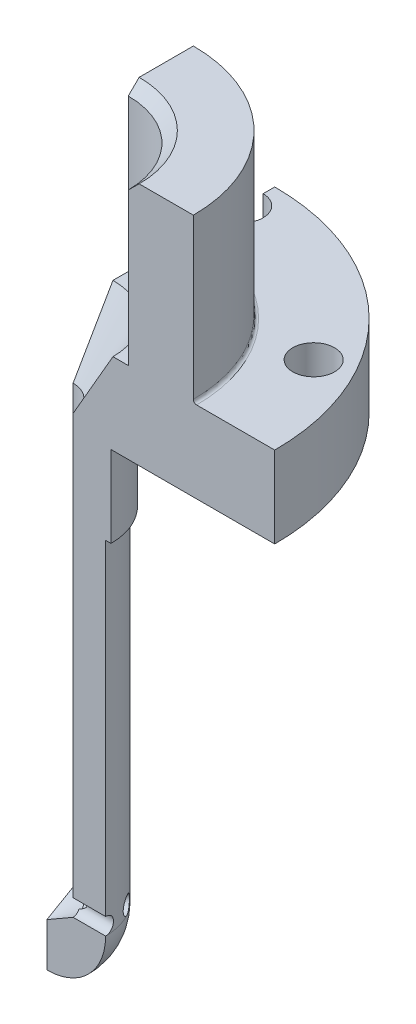
from build123d import *

# Parameters (mm, degrees)
SKETCH1_W           = 2.54
SKETCH1_H           = 26.74112
SKETCH3_R           = 4.5847
SKETCH3_R_2         = 2.0447
BOSS_EXTRUDE1_DEPTH = 6.35
BOSS_EXTRUDE2_START = 6.35
SKETCH4_R           = 17.78
SKETCH4_R_2         = 2.0447
BOSS_EXTRUDE2_DEPTH = 6.35
CUT_EXTRUDE2_REACH  = 48.775
SKETCH11_R          = 1.63195
CIRPATTERN2_COUNT   = 6
CHAMFER1_SIZE       = 3.11277
CHAMFER1_SIZE2      = 5.391475792
SKETCH13_R          = 11.43
SKETCH13_R_2        = 6.35
BOSS_EXTRUDE4_DEPTH = 12.7
FILLET4_R           = 0.254
CHAMFER2_SIZE       = 0.851662
CHAMFER2_SIZE2      = 0.83947
SKETCH15_R          = 4.99999
SKETCH15_R_2        = 3.556
BOSS_EXTRUDE5_DEPTH = 6.35
CUT_EXTRUDE3_REACH  = 58.272
SKETCH20_R          = 0.6604
CIRPATTERN3_COUNT   = 12
CUT_EXTRUDE4_DEPTH  = 63.048976258


with BuildPart() as part:
    # Sketch1 → Revolve2 (revolve)
    with BuildSketch(Plane.XY, mode=Mode.PRIVATE) as revolve2_sk:
        with Locations((-3.3147, 9.708214136)):
            Rectangle(SKETCH1_W, SKETCH1_H)
    revolve(revolve2_sk.sketch.rotate(Axis((0, 8.215698649, 0), (0, -1, 0)), 270), axis=Axis((0, 8.215698649, 0), (0, -1, 0)))

    # Sketch3 → Boss-Extrude1 (add)
    with BuildSketch(Plane(origin=(0, 23.078774136, 0), x_dir=(-1, 0, 0), z_dir=(0, -1, 0))):
        with Locations(Location((0, 0, 0), (0, 0, 270))):
            Circle(SKETCH3_R)
        with Locations(Location((0, 0, 0), (0, 0, 270))):
            Circle(SKETCH3_R_2, mode=Mode.SUBTRACT)
    extrude(amount=-BOSS_EXTRUDE1_DEPTH)

    # Sketch4 → Boss-Extrude2 (add)
    with BuildSketch(Plane(origin=(0, 29.428774136, 0), x_dir=(1, 0, 0), z_dir=(0, 1, 0)).offset(BOSS_EXTRUDE2_START)):
        with Locations(Location((0, 0, 0), (0, 0, 270))):
            Circle(SKETCH4_R)
        with Locations(Location((0, 0, 0), (0, 0, 270))):
            Circle(SKETCH4_R_2, mode=Mode.SUBTRACT)
    extrude(amount=-BOSS_EXTRUDE2_DEPTH)

    # Sketch11 → Cut-Extrude2 (cut, up to next)
    with BuildSketch(Plane(origin=(0, 35.778774136, 0), x_dir=(1, 0, 0), z_dir=(0, 1, 0)), mode=Mode.PRIVATE) as cut_extrude2_sk1:
        with Locations(Location((0, -15.24, 0), (0, 0, 270))):
            Circle(SKETCH11_R)
    cut_extrude2_tool1 = extrude(cut_extrude2_sk1.sketch, amount=-CUT_EXTRUDE2_REACH, mode=Mode.PRIVATE) & part.part
    cut_extrude2 = cut_extrude2_tool1.solids().sort_by_distance((0, 35.778774, 15.24))[0]
    add(cut_extrude2, mode=Mode.SUBTRACT)

    # CirPattern2: Cut-Extrude2 ×6 about axis
    cirpattern2_axis = Axis((0, 0, 0), (0, 1, 0))
    for i in range(1, CIRPATTERN2_COUNT):
        add(cut_extrude2.rotate(cirpattern2_axis, i * 360 / CIRPATTERN2_COUNT), mode=Mode.SUBTRACT)

    # Chamfer1
    chamfer1_edges = [part.edges().sort_by_distance(p)[0] for p in [
        (0, 35.778774136, -2.0447),
    ]]
    chamfer1_side = [part.faces().sort_by_distance(p)[0] for p in [
        (0, 35.778774136, -17.277105657),
    ]]
    chamfer(chamfer1_edges, length=CHAMFER1_SIZE, length2=CHAMFER1_SIZE2, reference=chamfer1_side[0])

    # Sketch13 → Boss-Extrude4 (add)
    with BuildSketch(Plane(origin=(0, 35.778774136, 0), x_dir=(1, 0, 0), z_dir=(0, 1, 0))):
        with Locations(Location((0, 0, 0), (0, 0, 270))):
            Circle(SKETCH13_R)
        with Locations(Location((0, 0, 0), (0, 0, 270))):
            Circle(SKETCH13_R_2, mode=Mode.SUBTRACT)
    extrude(amount=BOSS_EXTRUDE4_DEPTH)

    # Fillet4
    fillet4_edges = [part.edges().sort_by_distance(p)[0] for p in [
        (0, 35.778774136, -11.43),
    ]]
    fillet(fillet4_edges, radius=FILLET4_R)

    # Chamfer2
    chamfer2_edges = [part.edges().sort_by_distance(p)[0] for p in [
        (0, 48.478774136, -6.35),
    ]]
    chamfer2_side = [part.faces().sort_by_distance(p)[0] for p in [
        (0, 48.478774136, -11.10671078),
    ]]
    chamfer(chamfer2_edges, length=CHAMFER2_SIZE, length2=CHAMFER2_SIZE2, reference=chamfer2_side[0])

    # Sketch15 → Boss-Extrude5 (add)
    with BuildSketch(Plane.XZ.offset(-29.428774136)):
        with Locations(Location((0, 0, 0), (0, 0, 90))):
            Circle(SKETCH15_R)
        Circle(SKETCH15_R_2, mode=Mode.SUBTRACT)
    extrude(amount=BOSS_EXTRUDE5_DEPTH)

    # Sketch19 → Revolve4 (revolve)
    with BuildSketch(Plane.XY):
        with BuildLine():
            Line((0, -3.662345864), (-4.5847, -3.662345864))
            ThreePointArc((-4.5847, -3.662345864), (-3.24187246, -6.904218324), (0, -8.247045864))
            Line((0, -8.247045864), (0, -3.662345864))
        make_face()
    revolve(axis=Axis((0, -3.662345864, 0), (0, -1, 0)))

    # Sketch20 → Cut-Extrude3 (cut, up to next)
    with BuildSketch(Plane.ZY.offset(4.5847), mode=Mode.PRIVATE) as cut_extrude3_sk1:
        with Locations(Location((0, -3.001945864, 0), (0, 0, 270.000000005))):
            Circle(SKETCH20_R)
    cut_extrude3_tool1 = extrude(cut_extrude3_sk1.sketch, amount=-CUT_EXTRUDE3_REACH, mode=Mode.PRIVATE) & part.part
    cut_extrude3 = cut_extrude3_tool1.solids().sort_by_distance((-4.5847, -3.001946, 0))[0]
    add(cut_extrude3, mode=Mode.SUBTRACT)

    # CirPattern3: Cut-Extrude3 ×12 about axis
    cirpattern3_axis = Axis((0, -3.662345864, 0), (0, -1, 0))
    for i in range(1, CIRPATTERN3_COUNT):
        add(cut_extrude3.rotate(cirpattern3_axis, i * 360 / CIRPATTERN3_COUNT), mode=Mode.SUBTRACT)

    # Sketch21 → Cut-Revolve4 (revolve, cut)
    with BuildSketch(Plane.XY, mode=Mode.PRIVATE) as cut_revolve4_sk:
        Polygon((0, -3.662345864), (-2.0447, -3.662345864), (0, -4.84285396), align=None)
    revolve(cut_revolve4_sk.sketch.rotate(Axis((0, -3.662345864, 0), (0, -1, 0)), 90), axis=Axis((0, -3.662345864, 0), (0, -1, 0)), mode=Mode.SUBTRACT)

    # Sketch22 → Cut-Extrude4 (cut, through all)
    with BuildSketch(Plane(origin=(0, 48.478774136, 0), x_dir=(1, 0, 0), z_dir=(0, 1, 0))):
        Polygon((0, 0), (0, 19.892792237), (-23.522788241, 19.892792237), (-23.522788241, -23.886235836), (22.70199559, -23.886235836), (22.70199559, 0), align=None)
    extrude(amount=-CUT_EXTRUDE4_DEPTH, mode=Mode.SUBTRACT)


solid = part.part
